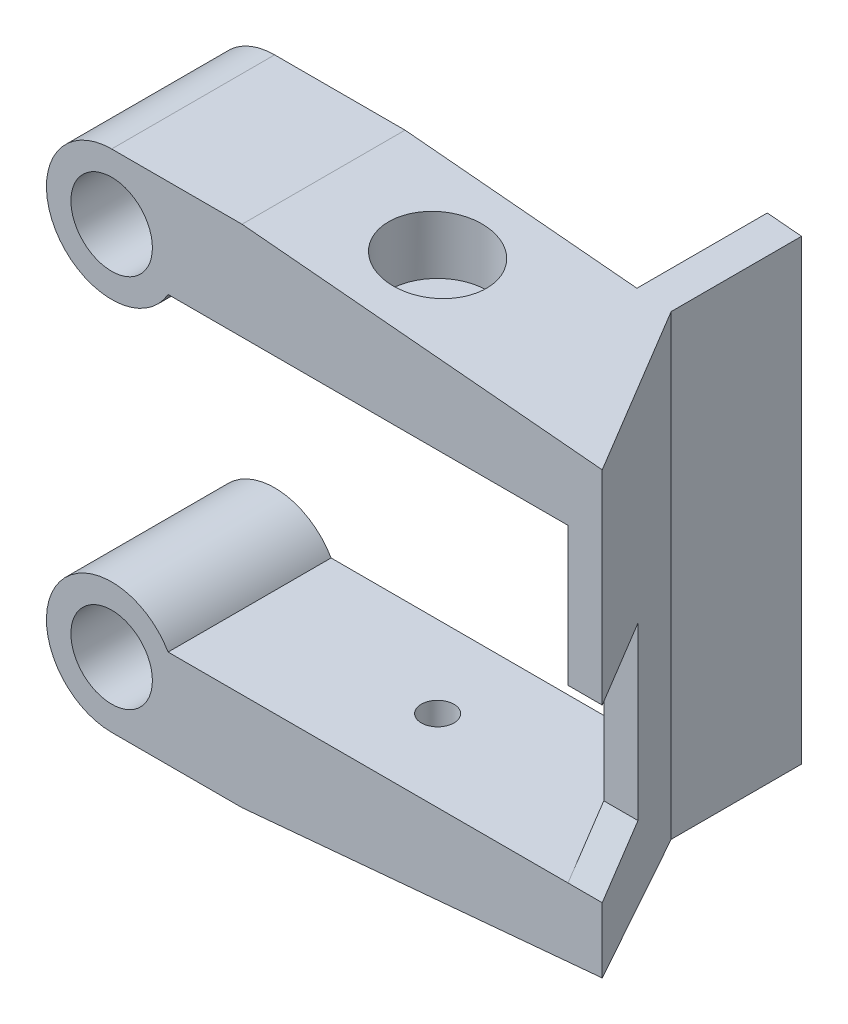
from build123d import *

# Parameters (mm, degrees)
CROQUIS1_R              = 2.5
SALIENTE_EXTRUIR1_DEPTH = 10
CROQUIS2_R              = 1
CORTAR_EXTRUIR1_DEPTH   = 4
CROQUIS3_R              = 3
CORTAR_EXTRUIR2_DEPTH   = 2
SALIENTE_EXTRUIR2_DEPTH = 13.5
SALIENTE_EXTRUIR3_START = 2
CROQUIS6_R              = 3
SALIENTE_EXTRUIR3_DEPTH = 2
CORTAR_EXTRUIR3_DEPTH   = 10
SALIENTE_EXTRUIR4_DEPTH = 8
CORTAR_EXTRUIR4_START   = 25.003066482
CORTAR_EXTRUIR4_DEPTH   = 5.096933518
CORTAR_EXTRUIR5_DEPTH   = 1


# Read off the part's stored shape, not the designer's step: Cortar-Extruir4
with BuildPart() as part:
    # Croquis1 → Saliente-Extruir1 (new body)
    with BuildSketch(Plane.XY):
        with BuildLine():
            Line((3.464101615, 3.5), (28, 3.5))
            Line((28, 3.5), (28, -0.5))
            Line((28, -0.5), (8, -0.5))
            Line((8, -0.5), (8, -2.5))
            Line((8, -2.5), (0, -2.5))
            ThreePointArc((0, -2.5), (-3.464101615, 3.5), (3.464101615, 3.5))
        make_face()
        with Locations((0, 1.5)):
            Circle(CROQUIS1_R, mode=Mode.SUBTRACT)
    extrude(amount=SALIENTE_EXTRUIR1_DEPTH)

    # Croquis2 → Cortar-Extruir1 (cut)
    with BuildSketch(Plane.XZ.offset(0.5)):
        with Locations(Location((15, 5, 0), (0, 0, 270))):
            Circle(CROQUIS2_R)
        Polygon((28, 10), (22.226497308, 0), (28, 0), align=None)
    extrude(amount=-CORTAR_EXTRUIR1_DEPTH, mode=Mode.SUBTRACT)

    # Croquis3 → Cortar-Extruir2 (cut)
    with BuildSketch(Plane.XZ.offset(0.5)):
        with Locations(Location((15, 5, 0), (0, 0, 270))):
            Circle(CROQUIS3_R)
    extrude(amount=-CORTAR_EXTRUIR2_DEPTH, mode=Mode.SUBTRACT)

    # Croquis4 → Saliente-Extruir2 (add)
    with BuildSketch(Plane.XZ.offset(0.5)):
        Polygon((28, 10), (30.1, 10), (24.326497308, 0), (22.226497308, 0), align=None)
    extrude(amount=-SALIENTE_EXTRUIR2_DEPTH)

    # Croquis6 → Saliente-Extruir3 (add)
    with BuildSketch(Plane.XZ.offset(0.5).offset(SALIENTE_EXTRUIR3_START)):
        Polygon((8, 10), (8, 0), (24.326497308, 0), (30.1, 10), align=None)
        with Locations(Location((15, 5, 0), (0, 0, 270))):
            Circle(CROQUIS6_R, mode=Mode.SUBTRACT)
    extrude(amount=-SALIENTE_EXTRUIR3_DEPTH)

    # Croquis7 → Cortar-Extruir3 (cut)
    with BuildSketch(Plane.XY.offset(10)):
        Polygon((30.1, -0.5), (8, -2.5), (30.1, -2.5), align=None)
    extrude(amount=-CORTAR_EXTRUIR3_DEPTH, mode=Mode.SUBTRACT)

    # Croquis8 → Saliente-Extruir4 (add)
    with BuildSketch(Plane(origin=(0, 0, 0), x_dir=(-1, 0, 0), z_dir=(0, 0, -1))):
        Polygon((-22.226497308, 13), (-24.326497308, 13), (-24.326497308, -1.022488931), (-22.226497308, -1.21253418), align=None)
    extrude(amount=SALIENTE_EXTRUIR4_DEPTH)

    # Simetría1: part across plane


with BuildPart() as part_1:
    add(part.part)
    add(part.part.mirror(Plane.ZX.offset(13)))

    # Cortar-Extruir4 outline → Cortar-Extruir4 (cut)
    with BuildSketch(Plane.YZ.offset(CORTAR_EXTRUIR4_START)):
        Polygon((3.771215703, 4.80915888), (14.271215703, 4.80915888), (14, 10), (3.5, 10), align=None)
    extrude(amount=CORTAR_EXTRUIR4_DEPTH, mode=Mode.SUBTRACT)

    # Croquis10 → Cortar-Extruir5 (cut)
    # profile 1 of 3: a face of its own
    with BuildSketch(Plane.XZ.offset(2.5)):
        with BuildLine():
            Line((1.162685686, 6.439391641), (0.848583122, 6.439391641))
            add(Edge.make_bspline(
                [(0.848583122, 6.439391641), (0.853721515, 6.468934864), (0.86384565, 6.527143633), (0.886915694, 6.611545535), (0.917637312, 6.69127396), (0.953603027, 6.767300855), (0.997718306, 6.838267438), (1.047316327, 6.905441886), (1.104946631, 6.967139727), (1.167528828, 7.025068855), (1.235014289, 7.077675463), (1.307120045, 7.122346789), (1.381632814, 7.161395534), (1.459522198, 7.193089671), (1.540726036, 7.216636812), (1.624339813, 7.234352909), (1.711148196, 7.24515013), (1.770060116, 7.246432243), (1.800005397, 7.247083948)],
                knots=[0, 0, 0, 0, 1.053304757, 2.075317675, 3.068179183, 4.052514018, 5.025721787, 5.999656851, 6.981831287, 7.987213101, 8.994102963, 9.982949043, 10.963611807, 11.947192756, 12.931972798, 13.930523328, 14.948072636, 16, 16, 16, 16], degree=3))
            add(Edge.make_bspline(
                [(1.800005397, 7.247083948), (1.831596588, 7.246263726), (1.893605886, 7.244653738), (1.984411193, 7.23235139), (2.071011136, 7.213163335), (2.153224698, 7.184702093), (2.230836775, 7.148210545), (2.304708521, 7.104257719), (2.37436666, 7.052445781), (2.438178546, 6.991952519), (2.49718563, 6.926516917), (2.548846046, 6.855518466), (2.59111876, 6.779234229), (2.627801889, 6.699691646), (2.654808128, 6.614835886), (2.674595473, 6.525700227), (2.68563037, 6.43195437), (2.687416657, 6.368137954), (2.688326711, 6.335625615)],
                knots=[0, 0, 0, 0, 1.062315377, 2.085183558, 3.076853664, 4.041450855, 5.005054491, 5.956881831, 6.928532668, 7.918549963, 8.909565511, 9.889228988, 10.864308296, 11.838912148, 12.830831495, 13.853185998, 14.906269772, 16, 16, 16, 16], degree=3))
            add(Edge.make_bspline(
                [(2.688326711, 6.335625615), (2.686863971, 6.293227095), (2.684021685, 6.210841498), (2.661540223, 6.092132556), (2.623303688, 5.983135892), (2.57858834, 5.900022458), (2.534121367, 5.83865355), (2.495304455, 5.793754167), (2.45114055, 5.749562453), (2.401138052, 5.706782809), (2.345405089, 5.665421935), (2.28434716, 5.625074823), (2.218363446, 5.584488783), (2.171301112, 5.560117599), (2.147060686, 5.547564718)],
                knots=[0, 0, 0, 0, 1.499598844, 2.913907084, 4.255683563, 5.573052951, 6.236393449, 6.934250511, 7.671053759, 8.445154725, 9.260560518, 10.125260916, 11.034376938, 12, 12, 12, 12], degree=3))
            add(Edge.make_bspline(
                [(2.147060686, 5.547564718), (2.182980285, 5.523159527), (2.253142512, 5.475488548), (2.345659388, 5.391381458), (2.423285714, 5.299296135), (2.488271382, 5.200676211), (2.537319452, 5.093339118), (2.573493706, 4.979028289), (2.594716474, 4.856810784), (2.597275954, 4.772907481), (2.598583122, 4.730056705)],
                knots=[0, 0, 0, 0, 1.064624726, 2.079545519, 3.056122326, 4.013672591, 4.968126873, 5.942090367, 6.948992187, 8, 8, 8, 8], degree=3))
            add(Edge.make_bspline(
                [(2.598583122, 4.730056705), (2.596698224, 4.678738564), (2.592975516, 4.577384278), (2.563151052, 4.428273826), (2.514391224, 4.285084308), (2.447234022, 4.148446915), (2.362382738, 4.021804722), (2.262243381, 3.906933942), (2.146064439, 3.806874968), (2.016652598, 3.72169086), (1.877210617, 3.653177116), (1.730663305, 3.603695018), (1.578553982, 3.573079971), (1.475060329, 3.569436511), (1.422801872, 3.567596769)],
                knots=[0, 0, 0, 0, 1.004874671, 1.984646221, 2.966438109, 3.961709977, 4.958676373, 5.945134406, 6.938497793, 7.953256374, 8.973116323, 9.973725145, 10.976845487, 12, 12, 12, 12], degree=3))
            add(Edge.make_bspline(
                [(1.422801872, 3.567596769), (1.38958003, 3.568433731), (1.324321058, 3.570077809), (1.228306639, 3.582200393), (1.136225215, 3.602372906), (1.04792792, 3.631338042), (0.96372238, 3.668631229), (0.883087032, 3.713783462), (0.806719494, 3.767304365), (0.734308647, 3.828183538), (0.667895875, 3.896828494), (0.608019446, 3.972207159), (0.555242828, 4.053955549), (0.509630459, 4.142037288), (0.470933997, 4.23606305), (0.440377223, 4.336674594), (0.415409288, 4.443191695), (0.405121301, 4.51704476), (0.399865173, 4.554776256)],
                knots=[0, 0, 0, 0, 1.015592156, 1.994967694, 2.953714725, 3.89374535, 4.831137841, 5.76533834, 6.714853956, 7.678276274, 8.653576723, 9.630054425, 10.617115938, 11.623871201, 12.658910274, 13.721192194, 14.835758172, 16, 16, 16, 16], degree=3))
            Line((0.399865173, 4.554776256), (0.713967737, 4.554776256))
            add(Edge.make_bspline(
                [(0.713967737, 4.554776256), (0.720787242, 4.515606597), (0.733639291, 4.441787394), (0.761761265, 4.339457298), (0.794701513, 4.251482444), (0.835448207, 4.176974523), (0.884923597, 4.113142553), (0.943530659, 4.057082453), (1.012077072, 4.006815936), (1.088719455, 3.96290608), (1.171394808, 3.926009414), (1.257996832, 3.901805215), (1.345888204, 3.883962731), (1.405415444, 3.882457894), (1.435422064, 3.881699333)],
                knots=[0, 0, 0, 0, 1.310091687, 2.469000878, 3.493463796, 4.400459837, 5.257309936, 6.145490497, 7.065451012, 8.052643887, 9.053215749, 10.040649124, 11.012326184, 12, 12, 12, 12], degree=3))
            add(Edge.make_bspline(
                [(1.435422064, 3.881699333), (1.462344687, 3.882528506), (1.515520783, 3.884166243), (1.594197778, 3.896639802), (1.670764003, 3.916225052), (1.745664131, 3.943570613), (1.818104017, 3.97999295), (1.889027757, 4.023202788), (1.957283782, 4.075225588), (2.023241991, 4.133245694), (2.083815725, 4.196724486), (2.137561503, 4.262684767), (2.182719465, 4.330591434), (2.220631014, 4.399911648), (2.248088744, 4.472163867), (2.269957795, 4.545055906), (2.281863999, 4.620292066), (2.283603523, 4.670891563), (2.284480557, 4.696402859)],
                knots=[0, 0, 0, 0, 0.998765887, 1.972707914, 2.948771611, 3.928374012, 4.925217491, 5.953083336, 7.006002037, 8.105848567, 9.210029586, 10.258437752, 11.259122355, 12.233064382, 13.183315866, 14.122098927, 15.053198292, 16, 16, 16, 16], degree=3))
            add(Edge.make_bspline(
                [(2.284480557, 4.696402859), (2.283270097, 4.729206695), (2.280871744, 4.794202794), (2.261637993, 4.889515515), (2.228662305, 4.980366869), (2.184000967, 5.066417387), (2.127582417, 5.145979649), (2.058431812, 5.21517327), (1.97899373, 5.275075555), (1.887116163, 5.323628821), (1.782392766, 5.361631337), (1.663733651, 5.38851258), (1.530267174, 5.40435647), (1.436402886, 5.406312033), (1.38704466, 5.407340359)],
                knots=[0, 0, 0, 0, 0.91172544, 1.806453237, 2.690400502, 3.591501907, 4.495060705, 5.391179975, 6.301027311, 7.251780241, 8.269539355, 9.39038931, 10.627744823, 12, 12, 12, 12], degree=3))
            Line((1.38704466, 5.407340359), (1.424905237, 5.721442923))
            Line((1.424905237, 5.721442923), (1.517453314, 5.718638436))
            add(Edge.make_bspline(
                [(1.517453314, 5.718638436), (1.548559044, 5.719104355), (1.609508951, 5.720017298), (1.69882482, 5.72930956), (1.783648661, 5.744664782), (1.863855455, 5.765667347), (1.939369893, 5.792146253), (2.010027702, 5.8253622), (2.076039172, 5.864866113), (2.137431951, 5.909295493), (2.192662224, 5.958323553), (2.241253862, 6.010042937), (2.282338792, 6.064599396), (2.316274157, 6.121039125), (2.341592783, 6.18046567), (2.360814159, 6.241397175), (2.372437379, 6.305269825), (2.373622762, 6.348665556), (2.374224147, 6.370681705)],
                knots=[0, 0, 0, 0, 1.24628212, 2.442018811, 3.593922291, 4.698034728, 5.761554064, 6.796478033, 7.821307851, 8.840472263, 9.829094753, 10.776759556, 11.679673515, 12.561550013, 13.408929098, 14.262137482, 15.118322481, 16, 16, 16, 16], degree=3))
            add(Edge.make_bspline(
                [(2.374224147, 6.370681705), (2.373626819, 6.390098815), (2.372456129, 6.428153938), (2.364954684, 6.484241044), (2.350498574, 6.537633141), (2.331680342, 6.588876257), (2.307762968, 6.638097188), (2.277143045, 6.684141839), (2.242004152, 6.728742359), (2.201464609, 6.77038428), (2.157262957, 6.808608106), (2.109890313, 6.841697098), (2.060467736, 6.870047595), (2.008440532, 6.893430291), (1.953307758, 6.91082691), (1.895803533, 6.923338524), (1.835980616, 6.931276948), (1.795355811, 6.932408071), (1.774765013, 6.932981384)],
                knots=[0, 0, 0, 0, 1.017722485, 1.994609554, 2.957110515, 3.910372255, 4.852475095, 5.817233168, 6.802300924, 7.824362143, 8.857880086, 9.860231714, 10.847656914, 11.840006958, 12.84318132, 13.87138813, 14.921106966, 16, 16, 16, 16], degree=3))
            add(Edge.make_bspline(
                [(1.774765013, 6.932981384), (1.736990763, 6.931448917), (1.663123847, 6.928452204), (1.556545324, 6.902479514), (1.458123297, 6.859803832), (1.369286491, 6.801034192), (1.292474403, 6.728155643), (1.231069562, 6.642679809), (1.186600698, 6.545341985), (1.170789858, 6.475295442), (1.162685686, 6.439391641)],
                knots=[0, 0, 0, 0, 1.055739269, 2.064480543, 3.048501583, 4.044208126, 5.029380081, 5.994799901, 6.972193286, 8, 8, 8, 8], degree=3))
        make_face()
    # profile 2 of 3: a face of its own
    with BuildSketch(Plane.XZ.offset(2.5)):
        with BuildLine():
            add(Edge.make_bspline(
                [(4.579252192, 7.247083948), (4.611807039, 7.245995657), (4.675921604, 7.243852341), (4.769831864, 7.227185378), (4.859861362, 7.200526436), (4.945640318, 7.162560527), (5.027006916, 7.113080262), (5.105322971, 7.054468217), (5.178153948, 6.983153488), (5.24758018, 6.902978043), (5.310793591, 6.812544713), (5.365333116, 6.712131931), (5.412667146, 6.603225223), (5.45015316, 6.48469246), (5.479441325, 6.357589965), (5.500280475, 6.221439732), (5.512984122, 6.076453661), (5.514481353, 5.976677971), (5.515249788, 5.925469365)],
                knots=[0, 0, 0, 0, 0.862726717, 1.699081786, 2.520498053, 3.347202637, 4.178215295, 5.040763974, 5.93476699, 6.875030527, 7.849681161, 8.853576535, 9.899908318, 10.99336013, 12.144709661, 13.354978701, 14.642476391, 16, 16, 16, 16], degree=3))
            add(Edge.make_bspline(
                [(5.515249788, 5.925469365), (5.514620289, 5.86585551), (5.513377569, 5.748169468), (5.502188456, 5.573962911), (5.486137189, 5.404240277), (5.461090702, 5.239432361), (5.43051529, 5.079085946), (5.392678524, 4.923458234), (5.347889118, 4.772472114), (5.296060714, 4.627358683), (5.239731028, 4.489988815), (5.181028894, 4.361409373), (5.118493506, 4.243968759), (5.054469474, 4.135816432), (4.985909898, 4.039222064), (4.916489736, 3.951350293), (4.842218967, 3.875641784), (4.766352571, 3.809131476), (4.687999236, 3.752379762), (4.60870793, 3.702853942), (4.527768586, 3.661752794), (4.446202277, 3.626449287), (4.362312943, 3.600898705), (4.277465515, 3.582063503), (4.191221995, 3.569179917), (4.133151529, 3.5681272), (4.103891615, 3.567596769)],
                knots=[0, 0, 0, 0, 1.417840176, 2.799013713, 4.150912842, 5.471708405, 6.7625667, 8.032669517, 9.279703417, 10.506991142, 11.696233478, 12.810550062, 13.867435083, 14.859899853, 15.797607937, 16.683162267, 17.520520521, 18.316460938, 19.08034531, 19.819286053, 20.537807717, 21.237833669, 21.930604121, 22.619796651, 23.304558187, 24, 24, 24, 24], degree=3))
            add(Edge.make_bspline(
                [(4.103891615, 3.567596769), (4.060745338, 3.56931393), (3.97616836, 3.572679975), (3.853394179, 3.600212992), (3.738457047, 3.644719512), (3.649531778, 3.696359044), (3.58372859, 3.746579957), (3.536341103, 3.788765193), (3.492314667, 3.836135379), (3.450210656, 3.887440303), (3.40993085, 3.942876458), (3.372937557, 4.003605996), (3.337905115, 4.068600719), (3.305647559, 4.138380119), (3.275823154, 4.212782278), (3.25085783, 4.292777509), (3.229907973, 4.378067384), (3.212570875, 4.468420856), (3.198436391, 4.563829612), (3.188737079, 4.664448597), (3.183240756, 4.770425869), (3.182365241, 4.842930879), (3.181916455, 4.880096769)],
                knots=[0, 0, 0, 0, 1.435486142, 2.813894703, 4.16658029, 5.526677663, 6.22086169, 6.92078, 7.636484549, 8.371846828, 9.129958256, 9.916110108, 10.737818826, 11.587357994, 12.474660306, 13.405010476, 14.375161658, 15.397738152, 16.467494513, 17.58566334, 18.762416952, 20, 20, 20, 20], degree=3))
            add(Edge.make_bspline(
                [(3.181916455, 4.880096769), (3.18261285, 4.942042952), (3.183982874, 5.063910239), (3.194107803, 5.243752181), (3.209856176, 5.417589353), (3.23282098, 5.585381982), (3.263426526, 5.746858618), (3.298712287, 5.902889566), (3.341357766, 6.052985261), (3.391214153, 6.196199303), (3.44550677, 6.331333967), (3.50312762, 6.457531068), (3.563657191, 6.573958803), (3.628229292, 6.679956145), (3.695580256, 6.776052658), (3.766528126, 6.861723086), (3.840208598, 6.938148921), (3.917534405, 7.004194132), (3.997360899, 7.060617994), (4.077028221, 7.111249909), (4.158888423, 7.15228265), (4.240918569, 7.187047395), (4.324173971, 7.214029547), (4.408500792, 7.232545564), (4.493552757, 7.245450024), (4.550692416, 7.246539435), (4.579252192, 7.247083948)],
                knots=[0, 0, 0, 0, 1.470791388, 2.893501234, 4.275600723, 5.614434664, 6.912857095, 8.17686219, 9.411686231, 10.615561684, 11.775855534, 12.868421853, 13.908428417, 14.889627493, 15.813393228, 16.692284126, 17.528148069, 18.331072678, 19.102586731, 19.8478506, 20.570031765, 21.273923614, 21.961841481, 22.644389209, 23.322433117, 24, 24, 24, 24], degree=3))
        make_face()
        with BuildLine():
            add(Edge.make_bspline(
                [(4.555414051, 6.932981384), (4.536439575, 6.932261313), (4.498245872, 6.930811882), (4.440735125, 6.920272915), (4.382364367, 6.904333441), (4.323076209, 6.88070908), (4.263296467, 6.850487008), (4.202267192, 6.814355713), (4.140718495, 6.771404424), (4.078272105, 6.721976467), (4.017103679, 6.664221375), (3.95820176, 6.598117814), (3.901868839, 6.523356199), (3.848783175, 6.439356075), (3.797521026, 6.346755629), (3.749466601, 6.244968825), (3.703948005, 6.134721821), (3.661388486, 6.016345394), (3.622042422, 5.890920216), (3.588693895, 5.758573672), (3.55972561, 5.620629474), (3.537217239, 5.476376721), (3.517604905, 5.326623149), (3.505734869, 5.170746346), (3.49766693, 5.009188677), (3.496575124, 4.899505133), (3.496019019, 4.843638436)],
                knots=[0, 0, 0, 0, 0.535590216, 1.078088953, 1.646503504, 2.242120821, 2.876684528, 3.536551845, 4.243209066, 4.994585865, 5.783597611, 6.615574094, 7.492013341, 8.4238755, 9.419375135, 10.479150357, 11.600588305, 12.786362483, 14.030464638, 15.311003394, 16.63899601, 18.009344201, 19.432868756, 20.902802065, 22.422459604, 24, 24, 24, 24], degree=3))
            add(Edge.make_bspline(
                [(3.496019019, 4.843638436), (3.496484341, 4.804121307), (3.497383084, 4.72779623), (3.506329623, 4.61715726), (3.518698891, 4.514154377), (3.538711249, 4.419404247), (3.562806749, 4.332115877), (3.59369781, 4.253138115), (3.629339537, 4.181431485), (3.670914165, 4.118192585), (3.71653445, 4.062723584), (3.76520957, 4.014564677), (3.81656314, 3.973823305), (3.870068323, 3.939559658), (3.926666203, 3.913317816), (3.986165907, 3.895273641), (4.048035885, 3.883472503), (4.090282453, 3.882294076), (4.111603955, 3.881699333)],
                knots=[0, 0, 0, 0, 1.484932994, 2.868063245, 4.170070992, 5.381165891, 6.504504114, 7.56970386, 8.563591869, 9.508896032, 10.407542569, 11.258515368, 12.077514383, 12.867109075, 13.641358872, 14.41376278, 15.199438864, 16, 16, 16, 16], degree=3))
            add(Edge.make_bspline(
                [(4.111603955, 3.881699333), (4.133852242, 3.882326183), (4.178400381, 3.883581337), (4.244760077, 3.895302227), (4.310200335, 3.914463327), (4.3749915, 3.940591585), (4.43926551, 3.973960833), (4.503098794, 4.01447006), (4.565441236, 4.063696738), (4.627835075, 4.118593639), (4.688110076, 4.1811702), (4.745467926, 4.250578437), (4.799545137, 4.326525484), (4.849901053, 4.408991218), (4.897705909, 4.497322752), (4.941751769, 4.592214659), (4.982610235, 4.693586266), (5.00657432, 4.764054807), (5.018855557, 4.800168884)],
                knots=[0, 0, 0, 0, 0.77604706, 1.553892808, 2.343877876, 3.152800139, 3.98830987, 4.868615572, 5.78728157, 6.75807329, 7.767676272, 8.816335789, 9.898351881, 11.019038633, 12.187032868, 13.402327443, 14.668731489, 16, 16, 16, 16], degree=3))
            add(Edge.make_bspline(
                [(5.018855557, 4.800168884), (5.033507953, 4.846558856), (5.062929976, 4.939709959), (5.099971966, 5.081952483), (5.130373255, 5.226683681), (5.156983865, 5.373379425), (5.175911361, 5.522762387), (5.191138744, 5.674207), (5.19949922, 5.828151426), (5.200594829, 5.931536642), (5.201147224, 5.983662474)],
                knots=[0, 0, 0, 0, 0.97088093, 1.949529747, 2.93210591, 3.92216045, 4.924261898, 5.936559817, 6.959633308, 8, 8, 8, 8], degree=3))
            add(Edge.make_bspline(
                [(5.201147224, 5.983662474), (5.200630195, 6.022004898), (5.199629478, 6.096217183), (5.191340354, 6.203974688), (5.176714955, 6.304221322), (5.156467108, 6.397282641), (5.13078072, 6.482997038), (5.099271653, 6.561251772), (5.062052981, 6.632241615), (5.01853287, 6.695196469), (4.970602644, 6.750691948), (4.919959176, 6.799355456), (4.866858225, 6.841284289), (4.809955699, 6.874327685), (4.750528156, 6.9006915), (4.688148473, 6.919495394), (4.622697921, 6.931255047), (4.578134237, 6.932398441), (4.555414051, 6.932981384)],
                knots=[0, 0, 0, 0, 1.430250887, 2.768270117, 4.028380119, 5.206661668, 6.318152812, 7.362403216, 8.349129852, 9.30195703, 10.210727286, 11.080171321, 11.919002126, 12.727940788, 13.528188044, 14.339050687, 15.153187666, 16, 16, 16, 16], degree=3))
        make_face(mode=Mode.SUBTRACT)
    # profile 3 of 3: a face of its own
    with BuildSketch(Plane.XZ.offset(2.5)):
        with BuildLine():
            add(Edge.make_bspline(
                [(6.763246583, 7.247083948), (6.786648468, 7.246356212), (6.832956778, 7.244916146), (6.900945916, 7.235121899), (6.966109478, 7.218231936), (7.028032324, 7.194106369), (7.087563719, 7.16371415), (7.144194503, 7.126566818), (7.198035088, 7.08265066), (7.24785361, 7.032261021), (7.294562788, 6.977329064), (7.334083441, 6.916588307), (7.36911502, 6.852434482), (7.397035127, 6.783752401), (7.41793264, 6.710773554), (7.4332488, 6.633868074), (7.44356601, 6.552784497), (7.444342055, 6.497149955), (7.444736968, 6.468838756)],
                knots=[0, 0, 0, 0, 0.970717871, 1.920883944, 2.842680434, 3.757311267, 4.672198984, 5.610669493, 6.561577208, 7.54876171, 8.546788736, 9.547073532, 10.549095219, 11.575307918, 12.615394826, 13.693467145, 14.826256018, 16, 16, 16, 16], degree=3))
            add(Edge.make_bspline(
                [(7.444736968, 6.468838756), (7.444228315, 6.435843674), (7.443232692, 6.371260082), (7.430588025, 6.276801088), (7.411810671, 6.186744712), (7.386106095, 6.100546957), (7.351632943, 6.019043911), (7.309081675, 5.942319211), (7.260083813, 5.869606124), (7.203321825, 5.802733053), (7.141239532, 5.742074494), (7.075320108, 5.688358328), (7.005208301, 5.643083667), (6.931653419, 5.605944933), (6.85439339, 5.576713595), (6.773667676, 5.556643879), (6.689301685, 5.5444055), (6.631944973, 5.542783208), (6.602689692, 5.541955743)],
                knots=[0, 0, 0, 0, 1.130854088, 2.213500164, 3.262022406, 4.283858738, 5.293169922, 6.29044296, 7.288617459, 8.29537939, 9.292942272, 10.261820963, 11.206697579, 12.149430033, 13.082848615, 14.033453143, 14.996945993, 16, 16, 16, 16], degree=3))
            add(Edge.make_bspline(
                [(6.602689692, 5.541955743), (6.578813311, 5.54263742), (6.532023196, 5.543973291), (6.46326104, 5.554276596), (6.39728756, 5.569956249), (6.33426096, 5.593395358), (6.274818091, 5.623730992), (6.217873294, 5.659955521), (6.163805302, 5.702673153), (6.113824042, 5.752320928), (6.068217354, 5.806975994), (6.028015744, 5.866003397), (5.994164078, 5.929473362), (5.967088753, 5.997104228), (5.945095015, 6.068080467), (5.929708845, 6.143202044), (5.920493987, 6.222277402), (5.919567714, 6.276472379), (5.919095942, 6.304075134)],
                knots=[0, 0, 0, 0, 0.998939331, 1.957603429, 2.904214697, 3.832710991, 4.764499105, 5.69253155, 6.653438724, 7.642559757, 8.635735374, 9.628718291, 10.626459594, 11.640042448, 12.673490826, 13.732455774, 14.845087277, 16, 16, 16, 16], degree=3))
            add(Edge.make_bspline(
                [(5.919095942, 6.304075134), (5.919990826, 6.337290984), (5.921741671, 6.402277945), (5.932942527, 6.497844014), (5.95245761, 6.588935053), (5.980174136, 6.675600605), (6.014292732, 6.758395336), (6.057504542, 6.836405501), (6.108196353, 6.910374374), (6.166071737, 6.979312046), (6.229379391, 7.041761753), (6.295975255, 7.097254916), (6.366789862, 7.142721871), (6.439808455, 7.181031804), (6.516210681, 7.210785498), (6.595716637, 7.231666142), (6.67844352, 7.244784409), (6.734684978, 7.246309465), (6.763246583, 7.247083948)],
                knots=[0, 0, 0, 0, 1.130922342, 2.21265473, 3.270805013, 4.297553847, 5.306888354, 6.314716204, 7.327776304, 8.355757729, 9.374178632, 10.352259942, 11.301297143, 12.233743801, 13.155811409, 14.086116658, 15.028055401, 16, 16, 16, 16], degree=3))
        make_face()
        with BuildLine():
            add(Edge.make_bspline(
                [(6.751327513, 6.977853179), (6.727167384, 6.976986136), (6.679045156, 6.975259157), (6.607780016, 6.958789525), (6.538083358, 6.93291757), (6.471121405, 6.896167466), (6.407980947, 6.85123848), (6.351943386, 6.796043677), (6.30239859, 6.732684849), (6.261628861, 6.660360581), (6.228535072, 6.582099105), (6.205457263, 6.498175806), (6.191177838, 6.409732646), (6.18928826, 6.349001706), (6.188326711, 6.31809757)],
                knots=[0, 0, 0, 0, 0.898823508, 1.790279833, 2.710439412, 3.660988812, 4.627551506, 5.588017192, 6.580694835, 7.614151002, 8.671642138, 9.738410943, 10.84914581, 12, 12, 12, 12], degree=3))
            add(Edge.make_bspline(
                [(6.188326711, 6.31809757), (6.189693432, 6.281517339), (6.192317189, 6.211292568), (6.215427151, 6.111410023), (6.255446167, 6.023526536), (6.309351253, 5.947730935), (6.376298302, 5.887375214), (6.452116326, 5.842494771), (6.536881518, 5.815532837), (6.596185756, 5.812657588), (6.626527833, 5.811186512)],
                knots=[0, 0, 0, 0, 1.167761783, 2.24180663, 3.250972385, 4.235329223, 5.192198183, 6.109164403, 7.032583837, 8, 8, 8, 8], degree=3))
            add(Edge.make_bspline(
                [(6.626527833, 5.811186512), (6.646663604, 5.811638425), (6.68598642, 5.812520956), (6.743637475, 5.822017366), (6.798151253, 5.837400039), (6.849951382, 5.858330238), (6.898194026, 5.886376225), (6.943671629, 5.919890516), (6.986213359, 5.959691295), (7.024954131, 6.005188608), (7.060374972, 6.054439612), (7.091532899, 6.10665655), (7.117639686, 6.161578716), (7.138226134, 6.219061206), (7.1555791, 6.278409767), (7.167288483, 6.340385836), (7.174489623, 6.404863261), (7.175164336, 6.448720579), (7.175506198, 6.470942121)],
                knots=[0, 0, 0, 0, 1.007750251, 1.968018882, 2.916659645, 3.840494567, 4.758079246, 5.703899357, 6.664595947, 7.668873183, 8.692139613, 9.699889865, 10.710423493, 11.732484109, 12.755080818, 13.804198226, 14.88743536, 16, 16, 16, 16], degree=3))
            add(Edge.make_bspline(
                [(7.175506198, 6.470942121), (7.174211017, 6.508246309), (7.171739054, 6.579444498), (7.148079722, 6.679803992), (7.110349139, 6.768630187), (7.055762978, 6.842700389), (6.991309548, 6.902874272), (6.918256607, 6.947110674), (6.836962154, 6.973287281), (6.780261668, 6.976310457), (6.751327513, 6.977853179)],
                knots=[0, 0, 0, 0, 1.207628711, 2.304861276, 3.322697533, 4.315405203, 5.264472711, 6.164993415, 7.063599473, 8, 8, 8, 8], degree=3))
        make_face(mode=Mode.SUBTRACT)
    extrude(amount=-CORTAR_EXTRUIR5_DEPTH, mode=Mode.SUBTRACT)


solid = part_1.part
